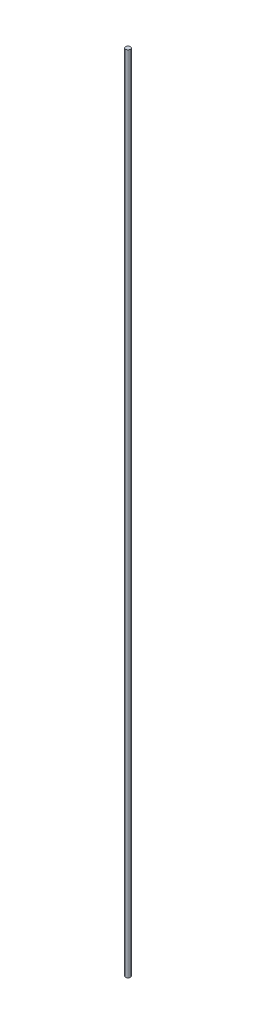
from build123d import *

# Parameters (mm, degrees)
SKETCH_2_W = 2.5
SKETCH_2_H = 844.6


with BuildPart() as part:
    # Эскиз2 → Повернуть1 (revolve)
    with BuildSketch(Plane.XY):
        with Locations((-1.25, 0)):
            Rectangle(SKETCH_2_W, SKETCH_2_H)
    revolve(axis=Axis((-2.5, 422.3, 0), (0, -1, 0)))


solid = part.part
